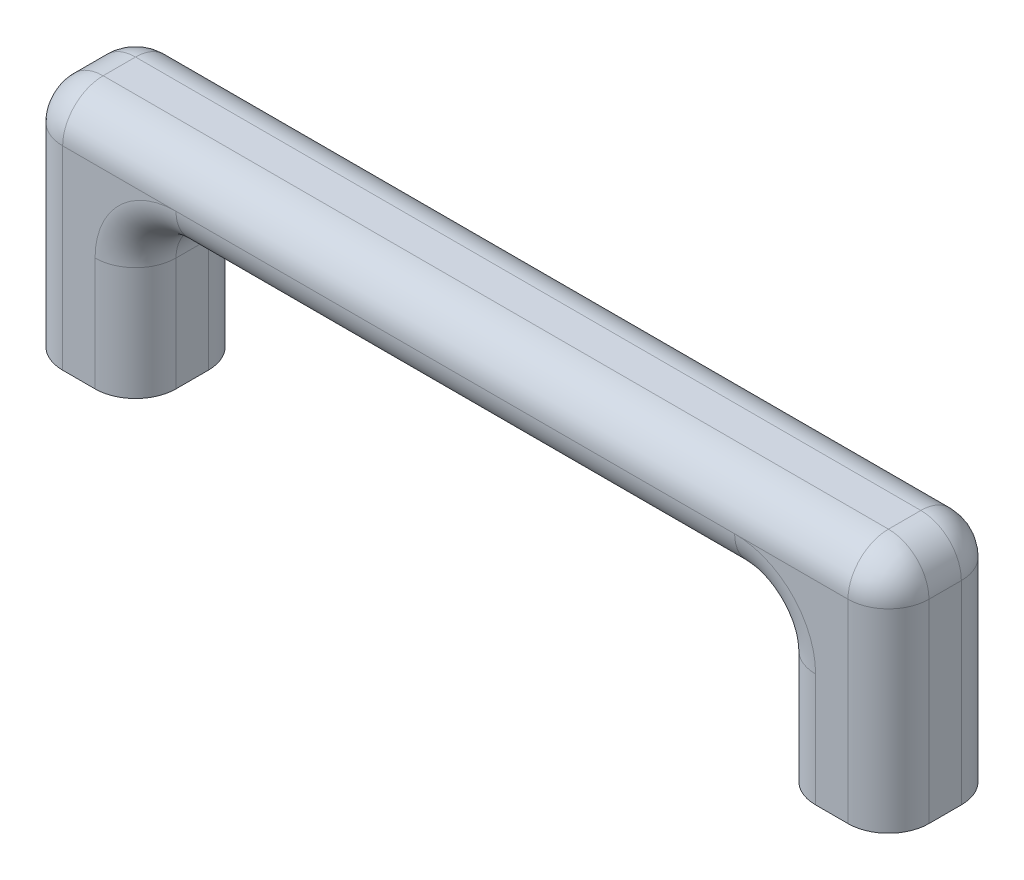
from build123d import *

# Parameters (mm, degrees)
ESQUISSE1_W             = 107
ESQUISSE1_H             = 29
BOSS_EXTRU_1_DEPTH      = 14
ESQUISSE2_W             = 79
ESQUISSE2_H             = 19
ENL_V_MAT_EXTRU_1_DEPTH = 58.170796741
CONG_1_R                = 5
ESQUISSE3_R             = 1.5
ENL_V_MAT_EXTRU_2_DEPTH = 5


with BuildPart() as part:
    # Esquisse1 → Boss.-Extru.1 (new body)
    with BuildSketch(Plane.XY):
        Rectangle(ESQUISSE1_W, ESQUISSE1_H)
    extrude(amount=BOSS_EXTRU_1_DEPTH)

    # Esquisse2 → Enlèv. mat.-Extru.1 (cut, through all)
    with BuildSketch(Plane.XY.offset(14)):
        with Locations((0, -5)):
            Rectangle(ESQUISSE2_W, ESQUISSE2_H)
    extrude(amount=-ENL_V_MAT_EXTRU_1_DEPTH, mode=Mode.SUBTRACT)

    # Congé1
    cong_1_edges = [part.edges().sort_by_distance(p)[0] for p in [
        (-53.5, 0, 14),
        (39.5, -5, 0),
        (39.5, 4.5, 7),
        (-39.5, -5, 0),
        (0, 4.5, 0),
        (-39.5, 4.5, 7),
        (39.5, -5, 14),
        (0, 4.5, 14),
        (-39.5, -5, 14),
        (53.5, 0, 14),
        (-53.5, 0, 0),
        (0, 14.5, 0),
        (53.5, 0, 0),
        (-53.5, 14.5, 7),
        (53.5, 14.5, 7),
        (0, 14.5, 14),
    ]]
    fillet(cong_1_edges, radius=CONG_1_R - 0.0001)  # a hair under: the kernel refuses the full size

    # Esquisse3 → Enlèv. mat.-Extru.2 (cut)
    with BuildSketch(Plane.XZ.offset(14.5)):
        with Locations(Location((-46.5, 7, 0), (0, 0, 270))):
            Circle(ESQUISSE3_R)
        with Locations(Location((46.5, 7, 0), (0, 0, 270))):
            Circle(ESQUISSE3_R)
    extrude(amount=-ENL_V_MAT_EXTRU_2_DEPTH, mode=Mode.SUBTRACT)


solid = part.part
